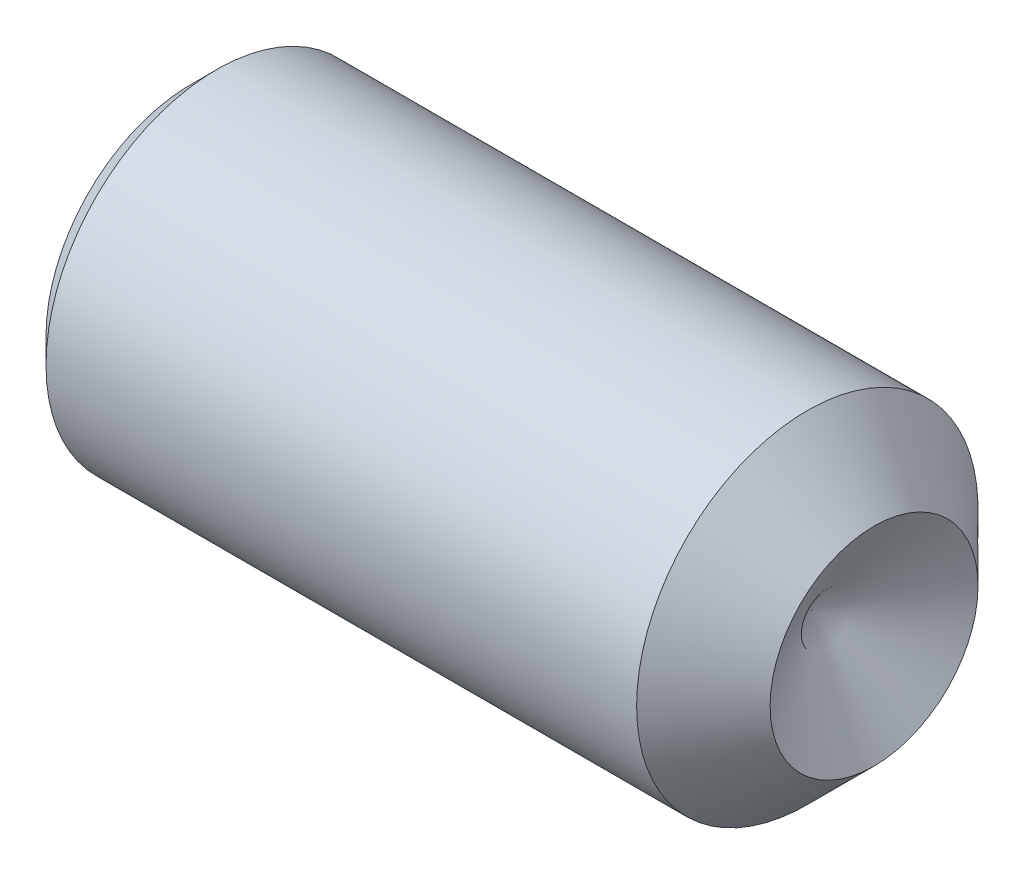
from build123d import *

# Parameters (mm, degrees)
HEX_2_DEPTH = 14.2748


with BuildPart() as part:
    # BodySke → BaseBody (revolve)
    with BuildSketch(Plane.XY):
        Polygon((0, 0), (0, 10.81024), (1.88976, 12.7), (45.8343, 12.7), (50.8, 7.7343), (46.152763714, 0), align=None)
    revolve(axis=Axis((-12.7, 0, 0), (1, 0, 0)))

    # Sketch2 → Hex 2 (cut)
    with BuildSketch(Plane.ZY):
        Polygon((4.120779811, 7.1374), (-4.120779811, 7.1374), (-8.241559623, 0), (-4.120779811, -7.1374), (4.120779811, -7.1374), (8.241559623, 0), align=None)
    extrude(amount=-HEX_2_DEPTH, mode=Mode.SUBTRACT)


solid = part.part
